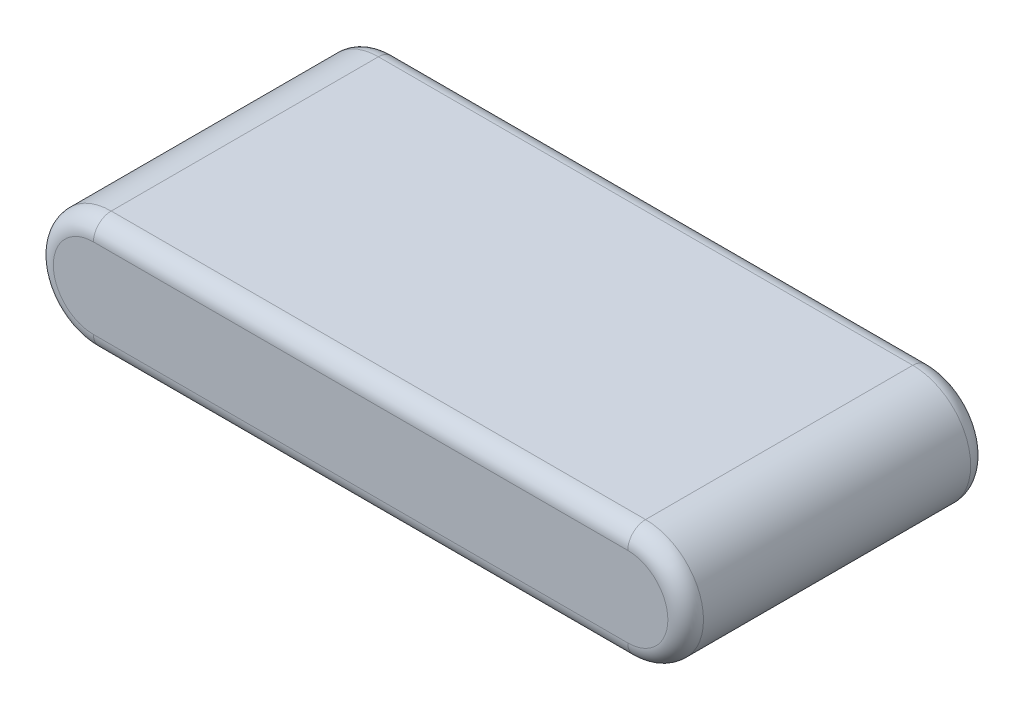
from build123d import *

# Parameters (mm, degrees)
RESSALTO_EXTRUS_O1_DEPTH = 17
FILETE1_R                = 1


with BuildPart() as part:
    # Esboço1 → Ressalto-extrusão1 (new body)
    with BuildSketch(Plane.XY):
        with BuildLine():
            Line((0, 3.25), (30, 3.25))
            ThreePointArc((30, 3.25), (33.25, 0), (30, -3.25))
            Line((30, -3.25), (0, -3.25))
            ThreePointArc((0, -3.25), (-3.25, 0), (0, 3.25))
        make_face()
    extrude(amount=RESSALTO_EXTRUS_O1_DEPTH)

    # Filete1
    filete1_edges = [part.edges().sort_by_distance(p)[0] for p in [
        (15, -3.25, 0),
        (33.25, 0, 0),
        (15, 3.25, 0),
        (-3.25, 0, 0),
        (15, 3.25, 17),
        (33.25, 0, 17),
        (15, -3.25, 17),
        (-3.25, 0, 17),
    ]]
    fillet(filete1_edges, radius=FILETE1_R)


solid = part.part
